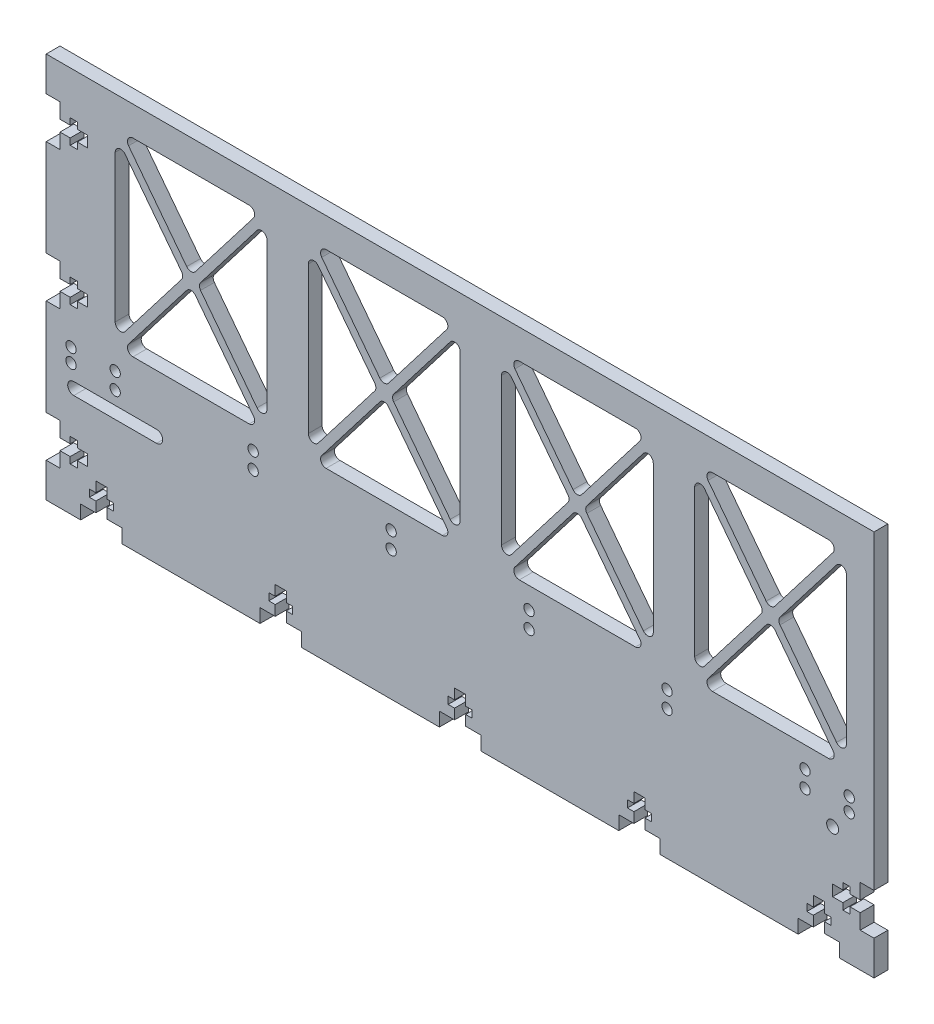
from build123d import *

# Parameters (mm, degrees)
SKETCH1_W              = 381
SKETCH1_H              = 177.8
BOSS_EXTRUDE1_DEPTH    = 6.35
CUT_EXTRUDE1_DEPTH     = 421.492761531
CUT_EXTRUDE2_DEPTH     = 421.492761531
LPATTERN1_COUNT        = 5
LPATTERN1_PITCH        = 82.55
CUT_EXTRUDE4_DEPTH     = 421.492761531
LPATTERN3_COUNT        = 2
LPATTERN3_PITCH        = 63.5
CUT_EXTRUDE5_DEPTH     = 421.492761531
M5_CLEARANCE_HOLE1_D   = 5.5
SKETCH12_R             = 2.38125
CUT_EXTRUDE6_DEPTH     = 421.492761531
LPATTERN4_COUNT        = 6
LPATTERN4_PITCH        = 63.5
SKETCH13_R             = 2.38125
CUT_EXTRUDE7_DEPTH     = 421.492761531
CUT_EXTRUDE10_DEPTH    = 421.492761531
FILLET1_R              = 2.54
LPATTERN5_COUNT        = 4
LPATTERN5_PITCH        = 88.9
FILLET1_OF_LPATTERN5_R = 2.54


with BuildPart() as part:
    # Sketch1 → Boss-Extrude1 (new body)
    with BuildSketch(Plane.XY):
        with Locations((190.5, 88.9)):
            Rectangle(SKETCH1_W, SKETCH1_H)
    extrude(amount=BOSS_EXTRUDE1_DEPTH)

    # Sketch2 → Cut-Extrude1 (cut, through all)
    with BuildSketch(Plane.XY.offset(6.35)):
        with BuildLine():
            Line((12.7, 53.594), (50.8, 53.594))
            ThreePointArc((50.8, 53.594), (53.594, 50.8), (50.8, 48.006))
            Line((50.8, 48.006), (12.7, 48.006))
            ThreePointArc((12.7, 48.006), (9.906, 50.8), (12.7, 53.594))
        make_face()
    extrude(amount=-CUT_EXTRUDE1_DEPTH, mode=Mode.SUBTRACT)

    # Sketch6 → Cut-Extrude2 (cut, through all)
    with BuildSketch(Plane.XY.offset(6.35)):
        Polygon((15.875, 0), (34.925, 0), (34.925, 6.35), (27.94, 6.35), (27.94, 11.049), (30.8991, 11.049), (30.8991, 14.351), (27.94, 14.351), (27.94, 19.05), (22.86, 19.05), (22.86, 14.351), (19.9009, 14.351), (19.9009, 11.049), (22.86, 11.049), (22.86, 6.35), (15.875, 6.35), align=None)
    cut_extrude2 = extrude(amount=-CUT_EXTRUDE2_DEPTH, mode=Mode.SUBTRACT)

    # LPattern1: Cut-Extrude2 ×5
    with Locations(*[(i * LPATTERN1_PITCH, 0, 0) for i in range(1, LPATTERN1_COUNT)]):
        add(cut_extrude2, mode=Mode.SUBTRACT)

    # Sketch8 → Cut-Extrude4 (cut, through all)
    with BuildSketch(Plane.XY.offset(6.35)):
        Polygon((0, 161.925), (0, 142.875), (6.35, 142.875), (6.35, 149.86), (11.049, 149.86), (11.049, 146.9009), (14.351, 146.9009), (14.351, 149.86), (19.05, 149.86), (19.05, 154.94), (14.351, 154.94), (14.351, 157.8991), (11.049, 157.8991), (11.049, 154.94), (6.35, 154.94), (6.35, 161.925), align=None)
    cut_extrude4 = extrude(amount=-CUT_EXTRUDE4_DEPTH, mode=Mode.SUBTRACT)

    # LPattern3: Cut-Extrude4 ×2
    with Locations(*[(0, -i * LPATTERN3_PITCH, 0) for i in range(1, LPATTERN3_COUNT)]):
        add(cut_extrude4, mode=Mode.SUBTRACT)

    # Sketch9 → Cut-Extrude5 (cut, through all)
    with BuildSketch(Plane.XY.offset(6.35)):
        Polygon((0, 34.925), (0, 15.875), (6.35, 15.875), (6.35, 22.86), (11.049, 22.86), (11.049, 19.9009), (14.351, 19.9009), (14.351, 22.86), (19.05, 22.86), (19.05, 27.94), (14.351, 27.94), (14.351, 30.8991), (11.049, 30.8991), (11.049, 27.94), (6.35, 27.94), (6.35, 34.925), align=None)
    cut_extrude5 = extrude(amount=-CUT_EXTRUDE5_DEPTH, mode=Mode.SUBTRACT)

    # Mirror2: Cut-Extrude5 across plane
    add(cut_extrude5.mirror(Plane.ZY.offset(-190.5)), mode=Mode.SUBTRACT)

    # M5 Clearance Hole1 (through all)
    with Locations(Plane.XY.offset(6.35)):
        with Locations((361.95, 50.8)):
            Hole(M5_CLEARANCE_HOLE1_D / 2)

    # Sketch12 → Cut-Extrude6 (cut, through all)
    with BuildSketch(Plane.XY.offset(6.35)):
        with Locations((31.75, 59.69)):
            Circle(SKETCH12_R)
        with Locations((31.75, 67.31)):
            Circle(SKETCH12_R)
    cut_extrude6 = extrude(amount=-CUT_EXTRUDE6_DEPTH, mode=Mode.SUBTRACT)

    # LPattern4: Cut-Extrude6 ×6
    with Locations(*[(i * LPATTERN4_PITCH, 0, 0) for i in range(1, LPATTERN4_COUNT)]):
        add(cut_extrude6, mode=Mode.SUBTRACT)

    # Sketch13 → Cut-Extrude7 (cut, through all)
    with BuildSketch(Plane.XY.offset(6.35)):
        with Locations((11.43, 66.675)):
            Circle(SKETCH13_R)
        with Locations((11.43, 60.325)):
            Circle(SKETCH13_R)
    cut_extrude7 = extrude(amount=-CUT_EXTRUDE7_DEPTH, mode=Mode.SUBTRACT)

    # Mirror3: Cut-Extrude7 across plane
    add(cut_extrude7.mirror(Plane.ZY.offset(-190.5)), mode=Mode.SUBTRACT)

    # Sketch14 → Cut-Extrude10 (cut, through all)
    with BuildSketch(Plane.XY.offset(6.35)):
        Polygon((31.75, 161.925), (31.75, 79.375), (63.5, 120.65), align=None)
        Polygon((101.6, 79.375), (69.85, 120.65), (101.6, 161.925), align=None)
        Polygon((34.769897398, 164.247997999), (66.675, 122.771364617), (98.580102602, 164.247997999), align=None)
        Polygon((66.675, 118.528635383), (98.580102602, 77.052002001), (34.769897398, 77.052002001), align=None)
    cut_extrude10 = extrude(amount=-CUT_EXTRUDE10_DEPTH, mode=Mode.SUBTRACT)

    # Fillet1
    fillet1_edges = [part.edges().sort_by_distance(p)[0] for p in [
        (63.5, 120.65, 3.175),
        (31.75, 79.375, 3.175),
        (31.75, 161.925, 3.175),
        (34.769897398, 164.247997999, 3.175),
        (66.675, 122.771364617, 3.175),
        (98.580102602, 164.247997999, 3.175),
        (101.6, 161.925, 3.175),
        (69.85, 120.65, 3.175),
        (101.6, 79.375, 3.175),
        (98.580102602, 77.052002001, 3.175),
        (34.769897398, 77.052002001, 3.175),
        (66.675, 118.528635383, 3.175),
    ]]
    fillet(fillet1_edges, radius=FILLET1_R)

    # LPattern5: Cut-Extrude10 ×4
    with Locations(*[(i * LPATTERN5_PITCH, 0, 0) for i in range(1, LPATTERN5_COUNT)]):
        add(cut_extrude10, mode=Mode.SUBTRACT)

    # Fillet1 of LPattern5
    fillet1_of_lpattern5_edges = [part.edges().sort_by_distance(p)[0] for p in [
        (152.4, 120.65, 3.175),
        (120.65, 79.375, 3.175),
        (120.65, 161.925, 3.175),
        (123.669897398, 164.247997999, 3.175),
        (155.575, 122.771364617, 3.175),
        (187.480102602, 164.247997999, 3.175),
        (190.5, 161.925, 3.175),
        (158.75, 120.65, 3.175),
        (190.5, 79.375, 3.175),
        (187.480102602, 77.052002001, 3.175),
        (123.669897398, 77.052002001, 3.175),
        (155.575, 118.528635383, 3.175),
        (241.3, 120.65, 3.175),
        (209.55, 79.375, 3.175),
        (209.55, 161.925, 3.175),
        (212.569897398, 164.247997999, 3.175),
        (244.475, 122.771364617, 3.175),
        (276.380102602, 164.247997999, 3.175),
        (279.4, 161.925, 3.175),
        (247.65, 120.65, 3.175),
        (279.4, 79.375, 3.175),
        (276.380102602, 77.052002001, 3.175),
        (212.569897398, 77.052002001, 3.175),
        (244.475, 118.528635383, 3.175),
        (330.2, 120.65, 3.175),
        (298.45, 79.375, 3.175),
        (298.45, 161.925, 3.175),
        (301.469897398, 164.247997999, 3.175),
        (333.375, 122.771364617, 3.175),
        (365.280102602, 164.247997999, 3.175),
        (368.3, 161.925, 3.175),
        (336.55, 120.65, 3.175),
        (368.3, 79.375, 3.175),
        (365.280102602, 77.052002001, 3.175),
        (301.469897398, 77.052002001, 3.175),
        (333.375, 118.528635383, 3.175),
    ]]
    fillet(fillet1_of_lpattern5_edges, radius=FILLET1_OF_LPATTERN5_R)


solid = part.part
